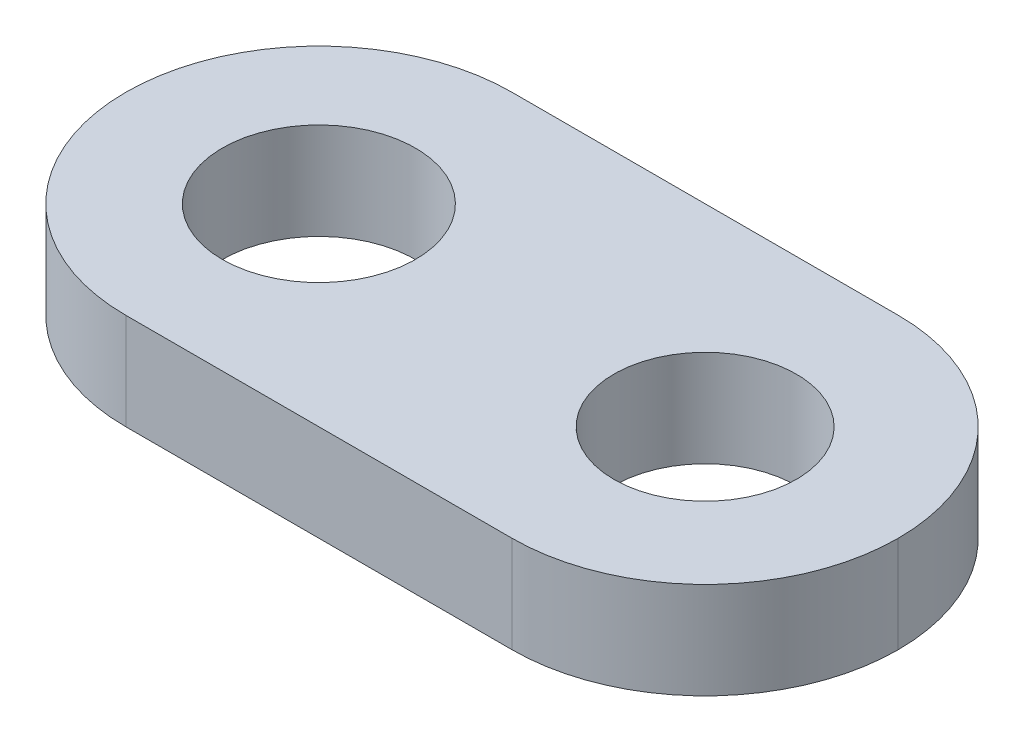
from build123d import *

# Parameters (mm, degrees)
SKETCH1_W           = 25.4
SKETCH1_H           = 12.7
SKETCH1_R           = 3
SKETCH1_R_2         = 3.175
BOSS_EXTRUDE1_DEPTH = 3.175
FILLET1_R           = 6.35


with BuildPart() as part:
    # Sketch1 → Boss-Extrude1 (new body)
    with BuildSketch(Plane(origin=(0, 0, 0), x_dir=(1, 0, 0), z_dir=(0, 1, 0))):
        with Locations((12.7, 6.35)):
            Rectangle(SKETCH1_W, SKETCH1_H)
        with Locations(Location((19.05, 6.35, 0), (0, 0, 270))):
            Circle(SKETCH1_R, mode=Mode.SUBTRACT)
        with Locations(Location((6.35, 6.35, 0), (0, 0, 270))):
            Circle(SKETCH1_R_2, mode=Mode.SUBTRACT)
    extrude(amount=BOSS_EXTRUDE1_DEPTH)

    # Fillet1
    fillet1_edges = [part.edges().sort_by_distance(p)[0] for p in [
        (25.4, 1.5875, 0),
        (25.4, 1.5875, -12.7),
        (0, 1.5875, -12.7),
        (0, 1.5875, 0),
    ]]
    fillet(fillet1_edges, radius=FILLET1_R - 0.0001)  # a hair under: the kernel refuses the full size


solid = part.part
